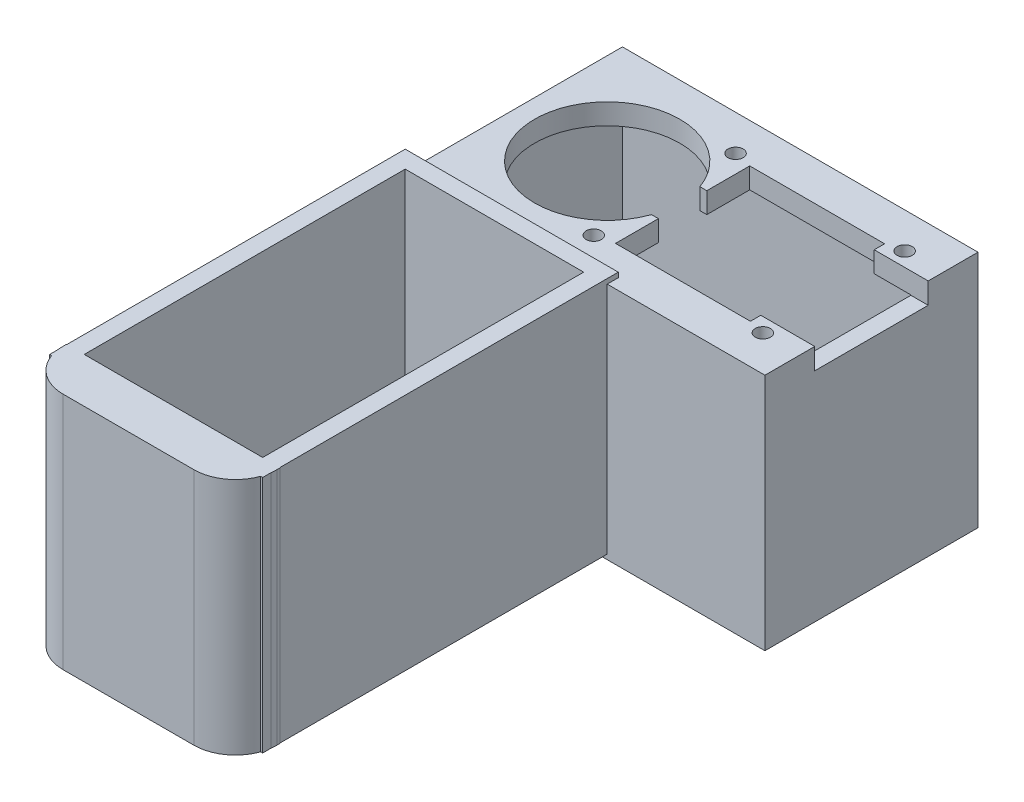
from build123d import *

# Parameters (mm, degrees)
S_BOX1_W        = 30.8
S_BOX1_H        = 34.5
BOSS_1_DEPTH    = 2.5
S_BOX2_W        = 30.8
S_BOX2_H        = 34.5
BOSS_2_DEPTH    = 2.5
S_BOX3_W        = 2.5
S_BOX3_H        = 34.5
BOSS_3_DEPTH    = 51.4
S_BOX4_W        = 2.5
S_BOX4_H        = 34.5
BOSS_4_DEPTH    = 51.4
S_BOX5_W        = 30.8
S_BOX5_H        = 3
BOSS_5_DEPTH    = 51.4
S_BOX6_W        = 2.5
S_BOX6_H        = 34.5
BOSS_6_DEPTH    = 30.8
S_BOX7_W        = 2.5
S_BOX7_H        = 34.5
BOSS_7_DEPTH    = 30.8
S_BOX8_W        = 51.4
S_BOX8_H        = 34.5
BOSS_8_DEPTH    = 2.5
S_BOX9_W        = 51.4
S_BOX9_H        = 34.5
BOSS_9_DEPTH    = 2.5
S_BOX10_W       = 51.4
S_BOX10_H       = 3
BOSS_10_DEPTH   = 30.8
BOSS_11_DEPTH   = 34.5
S_HOLE12_R      = 10.5
HOLE_12_DEPTH   = 3.2
S_CUT13_W       = 19.4
S_CUT13_H       = 3.15
POCKET_13_DEPTH = 19.5
S_CUT14_W       = 16.4
S_CUT14_H       = 3.15
POCKET_14_DEPTH = 8.3
S_CUT15_W       = 7
S_CUT15_H       = 3.15
POCKET_15_DEPTH = 11
S_HOLE16_R      = 1.1
HOLE_16_DEPTH   = 3.2
S_HOLE17_R      = 1.1
HOLE_17_DEPTH   = 3.2
S_HOLE18_R      = 1.1
HOLE_18_DEPTH   = 3.2
S_HOLE19_R      = 1.1
HOLE_19_DEPTH   = 3.2
S_HOLE20_R      = 10.5
HOLE_20_DEPTH   = 3.2
S_CUT21_W       = 19.5
S_CUT21_H       = 3.15
POCKET_21_DEPTH = 19.4
S_CUT22_W       = 8.3
S_CUT22_H       = 3.15
POCKET_22_DEPTH = 16.4
S_CUT23_W       = 11
S_CUT23_H       = 3.15
POCKET_23_DEPTH = 7
S_HOLE24_R      = 1.1
HOLE_24_DEPTH   = 3.2
S_HOLE25_R      = 1.1
HOLE_25_DEPTH   = 3.2
S_HOLE26_R      = 1.1
HOLE_26_DEPTH   = 3.2
S_HOLE27_R      = 1.1
HOLE_27_DEPTH   = 3.2


with BuildPart() as part:
    # S_box1 → Boss_1 (new body)
    with BuildSketch(Plane.XY.offset(-38.2)):
        with Locations((0, -20.15)):
            Rectangle(S_BOX1_W, S_BOX1_H)
    extrude(amount=BOSS_1_DEPTH)



with BuildPart() as body_2:
    # S_box2 → Boss_2 (new body)
    with BuildSketch(Plane.XY.offset(10.7)):
        with Locations((0, -20.15)):
            Rectangle(S_BOX2_W, S_BOX2_H)
    extrude(amount=BOSS_2_DEPTH)


with BuildPart() as part_1:
    add(part.part)

    add(body_2.part)  # Boss_3 merges body 2
    # S_box3 → Boss_3 (add)
    with BuildSketch(Plane.XY.offset(-38.2)):
        with Locations((-14.15, -20.15)):
            Rectangle(S_BOX3_W, S_BOX3_H)
    extrude(amount=BOSS_3_DEPTH)

    # S_box4 → Boss_4 (add)
    with BuildSketch(Plane.XY.offset(-38.2)):
        with Locations((14.15, -20.15)):
            Rectangle(S_BOX4_W, S_BOX4_H)
    extrude(amount=BOSS_4_DEPTH)

    # S_box5 → Boss_5 (add)
    with BuildSketch(Plane.XY.offset(-38.2)):
        with Locations((0, -35.9)):
            Rectangle(S_BOX5_W, S_BOX5_H)
    extrude(amount=BOSS_5_DEPTH)

    # S_box6 → Boss_6 (add)
    with BuildSketch(Plane.XY.offset(-67.4)):
        with Locations((-11.95, -20.85)):
            Rectangle(S_BOX6_W, S_BOX6_H)
    extrude(amount=BOSS_6_DEPTH)



with BuildPart() as body_2_2:
    # S_box7 → Boss_7 (new body)
    with BuildSketch(Plane.XY.offset(-67.4)):
        with Locations((36.95, -20.85)):
            Rectangle(S_BOX7_W, S_BOX7_H)
    extrude(amount=BOSS_7_DEPTH)


with BuildPart() as part_2:
    add(part_1.part)

    add(body_2_2.part)  # Boss_8 merges body 2 2
    # S_box8 → Boss_8 (add)
    with BuildSketch(Plane.XY.offset(-67.4)):
        with Locations((12.5, -20.85)):
            Rectangle(S_BOX8_W, S_BOX8_H)
    extrude(amount=BOSS_8_DEPTH)

    # S_box9 → Boss_9 (add)
    with BuildSketch(Plane.XY.offset(-39.1)):
        with Locations((12.5, -20.85)):
            Rectangle(S_BOX9_W, S_BOX9_H)
    extrude(amount=BOSS_9_DEPTH)

    # S_box10 → Boss_10 (add)
    with BuildSketch(Plane.XY.offset(-67.4)):
        with Locations((12.5, -5.1)):
            Rectangle(S_BOX10_W, S_BOX10_H)
    extrude(amount=BOSS_10_DEPTH)

    # S_prism11 → Boss_11 (add)
    with BuildSketch(Plane(origin=(0, -37.4, 0), x_dir=(1, 0, 0), z_dir=(0, 1, 0))):
        with BuildLine():
            Line((-15.45, -10.75), (15.45, -10.75))
            Line((15.45, -10.75), (15.45, -11.2))
            ThreePointArc((15.45, -11.2), (13.6926, -15.4426), (9.45, -17.2))
            Line((9.45, -17.2), (-9.45, -17.2))
            ThreePointArc((-9.45, -17.2), (-13.6926, -15.4426), (-15.45, -11.2))
            Line((-15.45, -11.2), (-15.45, -10.75))
        make_face()
    extrude(amount=BOSS_11_DEPTH)

    # S_hole12 → Hole_12 (cut)
    with BuildSketch(Plane(origin=(0, -37.5, 0), x_dir=(1, 0, 0), z_dir=(0, 1, 0))):
        Circle(S_HOLE12_R)
    extrude(amount=HOLE_12_DEPTH, mode=Mode.SUBTRACT)

    # S_cut13 → Pocket_13 (cut)
    with BuildSketch(Plane.XY.offset(-30.4)):
        with Locations((0, -35.925)):
            Rectangle(S_CUT13_W, S_CUT13_H)
    extrude(amount=POCKET_13_DEPTH, mode=Mode.SUBTRACT)

    # S_cut14 → Pocket_14 (cut)
    with BuildSketch(Plane.XY.offset(-38.7)):
        with Locations((0, -35.925)):
            Rectangle(S_CUT14_W, S_CUT14_H)
    extrude(amount=POCKET_14_DEPTH, mode=Mode.SUBTRACT)

    # S_cut15 → Pocket_15 (cut)
    with BuildSketch(Plane.XY.offset(-11)):
        with Locations((0, -35.925)):
            Rectangle(S_CUT15_W, S_CUT15_H)
    extrude(amount=POCKET_15_DEPTH, mode=Mode.SUBTRACT)

    # S_hole16 → Hole_16 (cut)
    with BuildSketch(Plane(origin=(0, -37.5, 0), x_dir=(1, 0, 0), z_dir=(0, 1, 0))):
        with Locations((-10.25, 8.3)):
            Circle(S_HOLE16_R)
    extrude(amount=HOLE_16_DEPTH, mode=Mode.SUBTRACT)

    # S_hole17 → Hole_17 (cut)
    with BuildSketch(Plane(origin=(0, -37.5, 0), x_dir=(1, 0, 0), z_dir=(0, 1, 0))):
        with Locations((10.25, 8.3)):
            Circle(S_HOLE17_R)
    extrude(amount=HOLE_17_DEPTH, mode=Mode.SUBTRACT)

    # S_hole18 → Hole_18 (cut)
    with BuildSketch(Plane(origin=(0, -37.5, 0), x_dir=(1, 0, 0), z_dir=(0, 1, 0))):
        with Locations((-10.25, 32.75)):
            Circle(S_HOLE18_R)
    extrude(amount=HOLE_18_DEPTH, mode=Mode.SUBTRACT)

    # S_hole19 → Hole_19 (cut)
    with BuildSketch(Plane(origin=(0, -37.5, 0), x_dir=(1, 0, 0), z_dir=(0, 1, 0))):
        with Locations((10.25, 32.75)):
            Circle(S_HOLE19_R)
    extrude(amount=HOLE_19_DEPTH, mode=Mode.SUBTRACT)

    # S_hole20 → Hole_20 (cut)
    with BuildSketch(Plane(origin=(0, -6.7, 0), x_dir=(1, 0, 0), z_dir=(0, 1, 0))):
        with Locations((0, 52)):
            Circle(S_HOLE20_R)
    extrude(amount=HOLE_20_DEPTH, mode=Mode.SUBTRACT)

    # S_cut21 → Pocket_21 (cut)
    with BuildSketch(Plane.XY.offset(-61.7)):
        with Locations((20.65, -5.075)):
            Rectangle(S_CUT21_W, S_CUT21_H)
    extrude(amount=POCKET_21_DEPTH, mode=Mode.SUBTRACT)

    # S_cut22 → Pocket_22 (cut)
    with BuildSketch(Plane.XY.offset(-60.2)):
        with Locations((34.55, -5.075)):
            Rectangle(S_CUT22_W, S_CUT22_H)
    extrude(amount=POCKET_22_DEPTH, mode=Mode.SUBTRACT)

    # S_cut23 → Pocket_23 (cut)
    with BuildSketch(Plane.XY.offset(-55.5)):
        with Locations((5.5, -5.075)):
            Rectangle(S_CUT23_W, S_CUT23_H)
    extrude(amount=POCKET_23_DEPTH, mode=Mode.SUBTRACT)

    # S_hole24 → Hole_24 (cut)
    with BuildSketch(Plane(origin=(0, -6.7, 0), x_dir=(1, 0, 0), z_dir=(0, 1, 0))):
        with Locations((8.3, 62.25)):
            Circle(S_HOLE24_R)
    extrude(amount=HOLE_24_DEPTH, mode=Mode.SUBTRACT)

    # S_hole25 → Hole_25 (cut)
    with BuildSketch(Plane(origin=(0, -6.7, 0), x_dir=(1, 0, 0), z_dir=(0, 1, 0))):
        with Locations((8.3, 41.75)):
            Circle(S_HOLE25_R)
    extrude(amount=HOLE_25_DEPTH, mode=Mode.SUBTRACT)

    # S_hole26 → Hole_26 (cut)
    with BuildSketch(Plane(origin=(0, -6.7, 0), x_dir=(1, 0, 0), z_dir=(0, 1, 0))):
        with Locations((32.75, 62.25)):
            Circle(S_HOLE26_R)
    extrude(amount=HOLE_26_DEPTH, mode=Mode.SUBTRACT)

    # S_hole27 → Hole_27 (cut)
    with BuildSketch(Plane(origin=(0, -6.7, 0), x_dir=(1, 0, 0), z_dir=(0, 1, 0))):
        with Locations((32.75, 41.75)):
            Circle(S_HOLE27_R)
    extrude(amount=HOLE_27_DEPTH, mode=Mode.SUBTRACT)


solid = part_2.part
